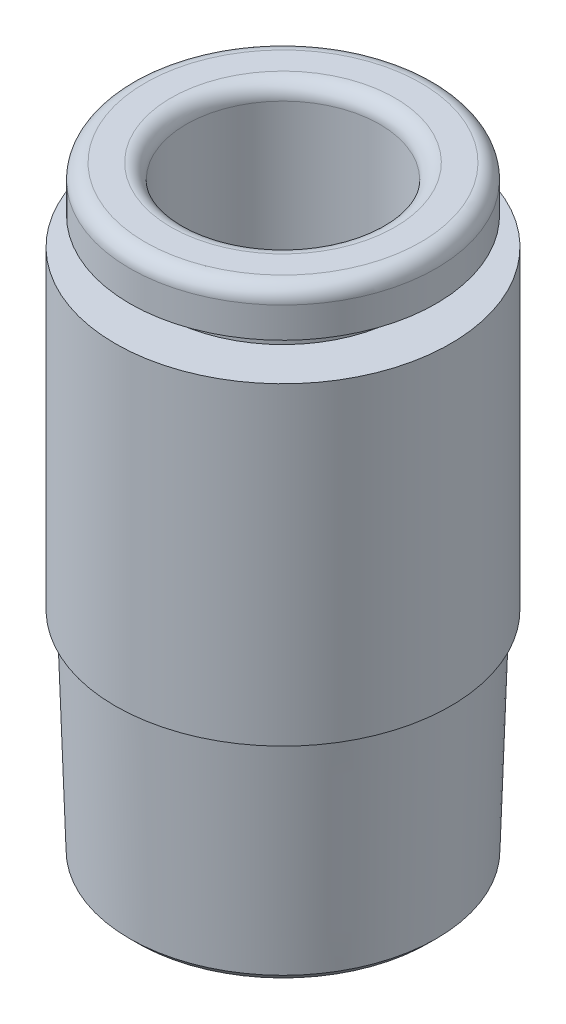
from build123d import *

# Parameters (mm, degrees)
UBODY_SKETCH_R = 5.5
UBODY_DEPTH    = 10.3
TUBE_START     = -13.3
TUBE_SKETCH_R  = 3.175
TUBE_DEPTH     = 13.3
TUBE_RADIUS_R  = 0.5
HEX_2_DEPTH    = 2
HEX_2_DRAFT    = -2
PORT_SKETCH_R  = 2.310158461
PORT_DEPTH     = 18.163624326


with BuildPart() as part:
    # Release_Sketch → Release (revolve)
    with BuildSketch(Plane.XY, mode=Mode.PRIVATE) as release_sk:
        with BuildLine():
            Line((0, 0), (-4.525, 0))
            ThreePointArc((-4.525, 0), (-4.878553391, -0.146446609), (-5.025, -0.5))
            Line((-5.025, -0.5), (-5.025, -1.5))
            Line((-5.025, -1.5), (-3.925, -1.5))
            Line((-3.925, -1.5), (-3.925, -2.4))
            Line((-3.925, -2.4), (0, -2.4))
            Line((0, -2.4), (0, 0))
        make_face()
    revolve(release_sk.sketch.rotate(Axis((0, 0, 0), (0, -1, 0)), 270), axis=Axis((0, 0, 0), (0, -1, 0)))

    # UBody_Sketch → UBody (add)
    with BuildSketch(Plane(origin=(0, -2.4, 0), x_dir=(-1, 0, 0), z_dir=(0, 1, 0))):
        with Locations(Location((0, 0, 0), (0, 0, 90))):
            Circle(UBODY_SKETCH_R)
    extrude(amount=-UBODY_DEPTH)

    # Thread_Sketch → Thread (revolve)
    with BuildSketch(Plane.XY, mode=Mode.PRIVATE) as thread_sk:
        Polygon((-5.247489296, -12.7), (-5.026347442, -19.8), (0, -19.8), (0, -12.7), align=None)
    revolve(thread_sk.sketch.rotate(Axis((0, 0, 0), (0, -1, 0)), 270), axis=Axis((0, 0, 0), (0, -1, 0)))

    # Thread_Chamfer: read off the stored shape, not the designer's step
    # Thread_Chamfer outline → Thread_Chamfer (revolve, cut)
    with BuildSketch(Plane.XY):
        Polygon((5.034384454, -19.541962988), (4.776347442, -19.8), (5.034384454, -19.8), align=None)
    revolve(axis=Axis((0, 0, 0), (0, 1, 0)), mode=Mode.SUBTRACT)

    # Tube_Sketch → Tube (cut)
    with BuildSketch(Plane(origin=(0, 0, 0), x_dir=(1, 0, 0), z_dir=(0, 1, 0)).offset(TUBE_START)):
        with Locations(Location((0, 0, 0), (0, 0, 270))):
            Circle(TUBE_SKETCH_R)
    extrude(amount=TUBE_DEPTH, mode=Mode.SUBTRACT)

    # Tube_Radius
    tube_radius_edges = [part.edges().sort_by_distance(p)[0] for p in [
        (0, 0, -3.175),
    ]]
    fillet(tube_radius_edges, radius=TUBE_RADIUS_R)


with BuildPart() as hex_2_tool:
    # Hex_Sketch → Hex 2 (with draft: the straight prism first)
    with BuildSketch(Plane(origin=(0, -13.3, 0), x_dir=(-1, 0, 0), z_dir=(0, 1, 0))):
        Polygon((-2.748187281, 0), (-1.374093641, -2.38), (1.374093641, -2.38), (2.748187281, 0), (1.374093641, 2.38), (-1.374093641, 2.38), align=None)
    extrude(amount=-HEX_2_DEPTH)
    # Hex 2: the draft: its side faces are tilted about the plane it starts from
    hex_2_sides = [hex_2_tool.faces().sort_by_distance(p)[0] for p in [
        (2.061140461, -14.3, -1.19),
        (0, -14.3, -2.38),
        (-2.061140461, -14.3, -1.19),
        (-2.061140461, -14.3, 1.19),
        (0, -14.3, 2.38),
        (2.061140461, -14.3, 1.19),
    ]]
    draft(hex_2_sides, Plane(origin=(0, -13.3, 0), x_dir=(-1, 0, 0), z_dir=(0, 1, 0)), HEX_2_DRAFT)


with BuildPart() as part_1:
    add(part.part)

    # Hex 2: cut by hex_2_tool
    add(hex_2_tool.part, mode=Mode.SUBTRACT)

    # Port_Sketch → Port (cut, through all)
    with BuildSketch(Plane(origin=(0, -15.3, 0), x_dir=(-1, 0, 0), z_dir=(0, 1, 0))):
        with Locations(Location((0, 0, 0), (0, 0, 90))):
            Circle(PORT_SKETCH_R)
    extrude(amount=-PORT_DEPTH, mode=Mode.SUBTRACT)


solid = part_1.part
